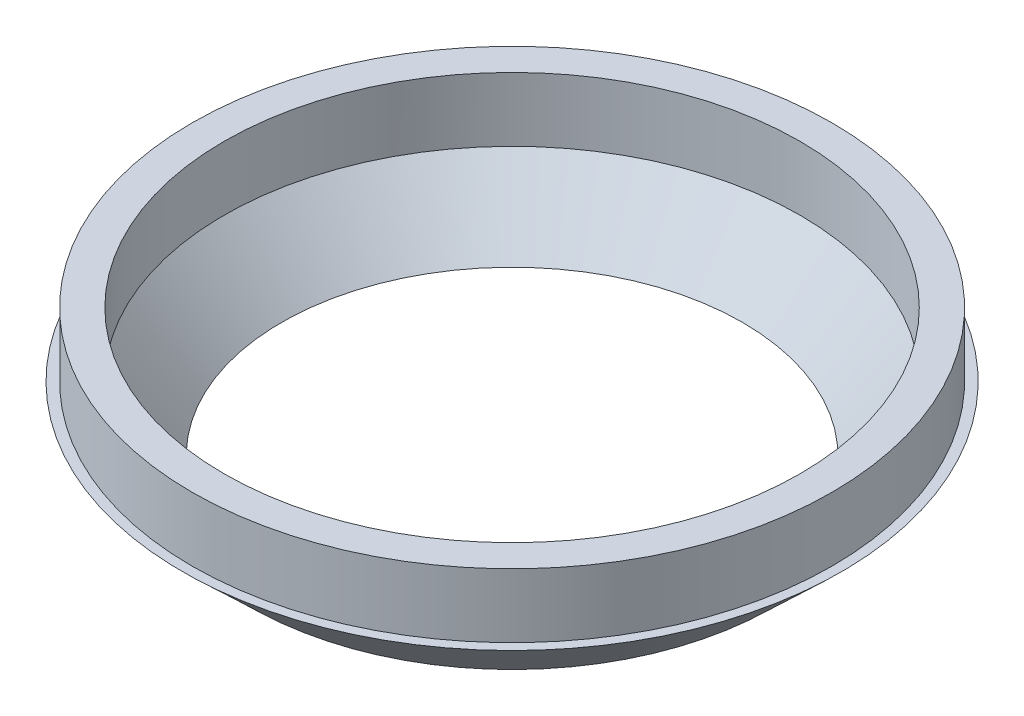
from build123d import *

# Parameters (mm, degrees)
SKETCH3_R           = 63.5
SKETCH3_R_2         = 57.15
BOSS_EXTRUDE1_DEPTH = 12.7


with BuildPart() as part:
    # Sketch2 → Revolve1 (revolve)
    with BuildSketch(Plane.XY):
        Polygon((-45.72, 0), (-52.07, 0), (-65.405, 12.7), (-57.15, 12.7), align=None)
    revolve(axis=Axis((0, 0, 0), (0, 1, 0)))

    # Sketch3 → Boss-Extrude1 (add)
    with BuildSketch(Plane(origin=(0, 12.7, 0), x_dir=(1, 0, 0), z_dir=(0, 1, 0))):
        Circle(SKETCH3_R)
        Circle(SKETCH3_R_2, mode=Mode.SUBTRACT)
    extrude(amount=BOSS_EXTRUDE1_DEPTH)


solid = part.part
